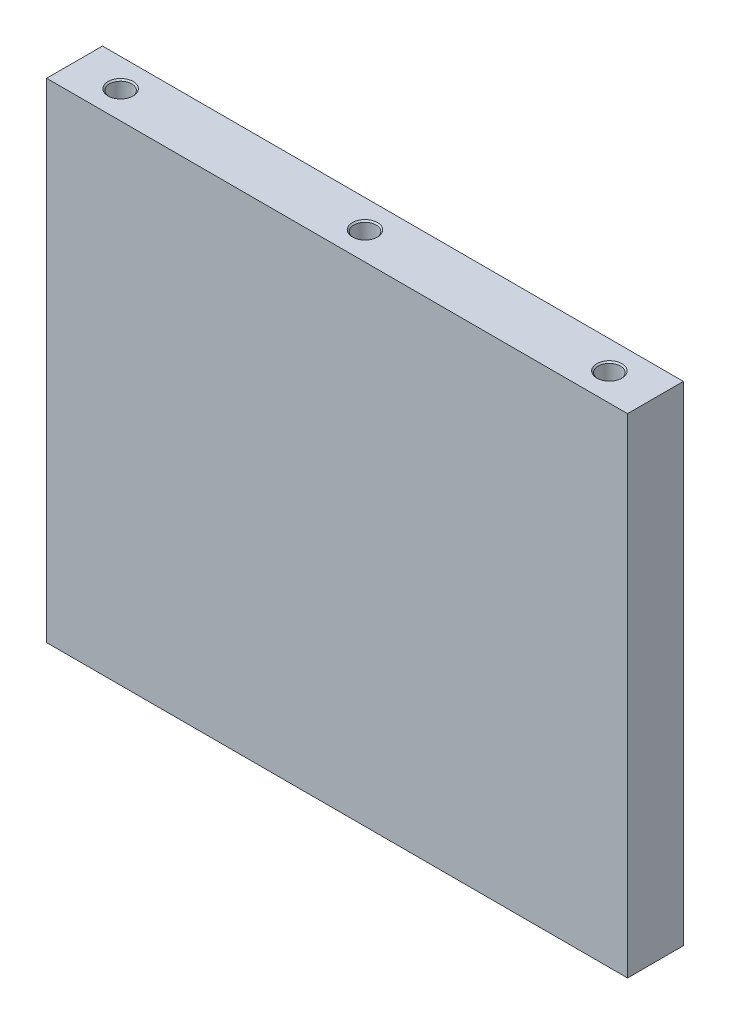
from build123d import *

# Parameters (mm, degrees)
SKETCH1_W           = 208
SKETCH1_H           = 20
BOSS_EXTRUDE1_DEPTH = 175
SKETCH2_R           = 4
CUT_EXTRUDE1_DEPTH  = 12
SKETCH3_R           = 4
CUT_EXTRUDE2_DEPTH  = 15
CHAMFER1_SIZE       = 0.5


with BuildPart() as part:
    # Sketch1 → Boss-Extrude1 (new body)
    with BuildSketch(Plane(origin=(0, 0, -58), x_dir=(1, 0, 0), z_dir=(0, 1, 0))):
        with Locations((0, -58)):
            Rectangle(SKETCH1_W, SKETCH1_H)
    extrude(amount=BOSS_EXTRUDE1_DEPTH)

    # Sketch2 → Cut-Extrude1 (cut)
    with BuildSketch(Plane(origin=(0, 175, 0), x_dir=(1, 0, 0), z_dir=(0, 1, 0))):
        Circle(SKETCH2_R)
        with Locations((-87.5, 0)):
            Circle(SKETCH2_R)
        with Locations((87.5, 0)):
            Circle(SKETCH2_R)
    extrude(amount=-CUT_EXTRUDE1_DEPTH, mode=Mode.SUBTRACT)

    # Sketch3 → Cut-Extrude2 (cut)
    with BuildSketch(Plane.XZ):
        with Locations((-55, 0)):
            Circle(SKETCH3_R)
        with Locations((55, 0)):
            Circle(SKETCH3_R)
    extrude(amount=-CUT_EXTRUDE2_DEPTH, mode=Mode.SUBTRACT)

    # Chamfer1
    chamfer1_edges = [part.edges().sort_by_distance(p)[0] for p in [
        (83.5, 175, 0),
        (-4, 175, 0),
        (-91.5, 175, 0),
        (-59, 0, 0),
        (51, 0, 0),
    ]]
    chamfer(chamfer1_edges, length=CHAMFER1_SIZE)


solid = part.part
